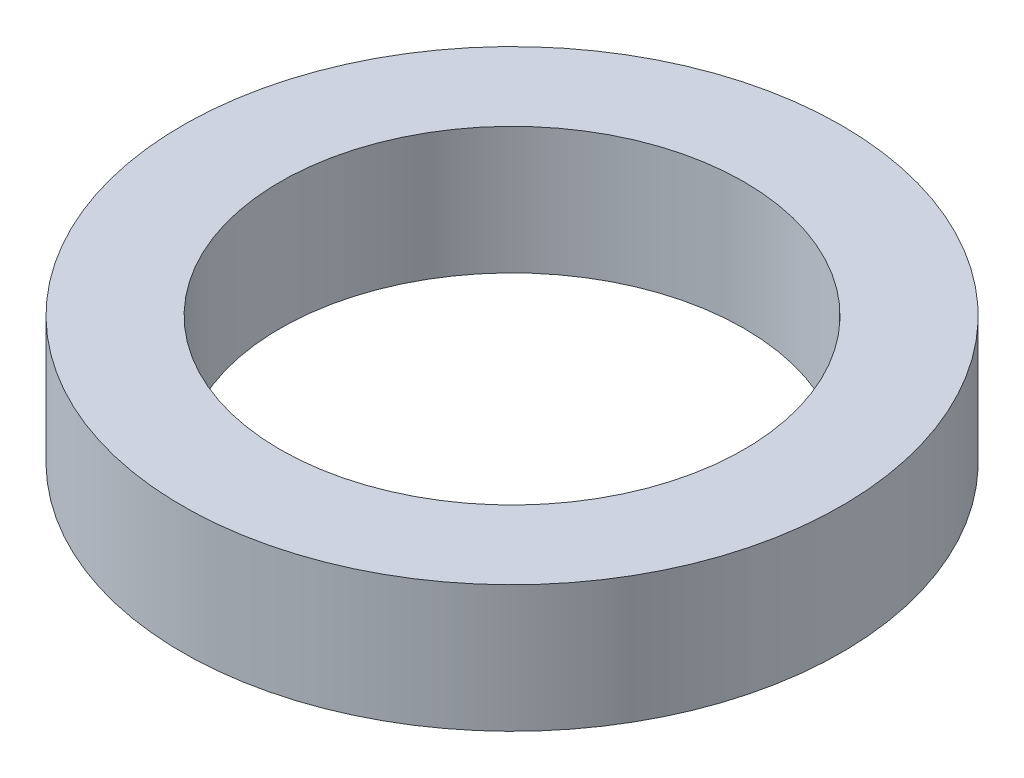
from build123d import *

# Parameters (mm, degrees)
SKETCH1_R           = 67.5
BOSS_EXTRUDE1_DEPTH = 26
SKETCH2_R           = 47.5
CUT_EXTRUDE1_DEPTH  = 99.936848545


with BuildPart() as part:
    # Sketch1 → Boss-Extrude1 (new body)
    with BuildSketch(Plane(origin=(0, 0, 0), x_dir=(1, 0, 0), z_dir=(0, 1, 0))):
        Circle(SKETCH1_R)
    extrude(amount=BOSS_EXTRUDE1_DEPTH)

    # Sketch2 → Cut-Extrude1 (cut, through all)
    with BuildSketch(Plane(origin=(0, 0, 0), x_dir=(1, 0, 0), z_dir=(0, 1, 0))):
        Circle(SKETCH2_R)
    extrude(amount=CUT_EXTRUDE1_DEPTH, mode=Mode.SUBTRACT)


solid = part.part
